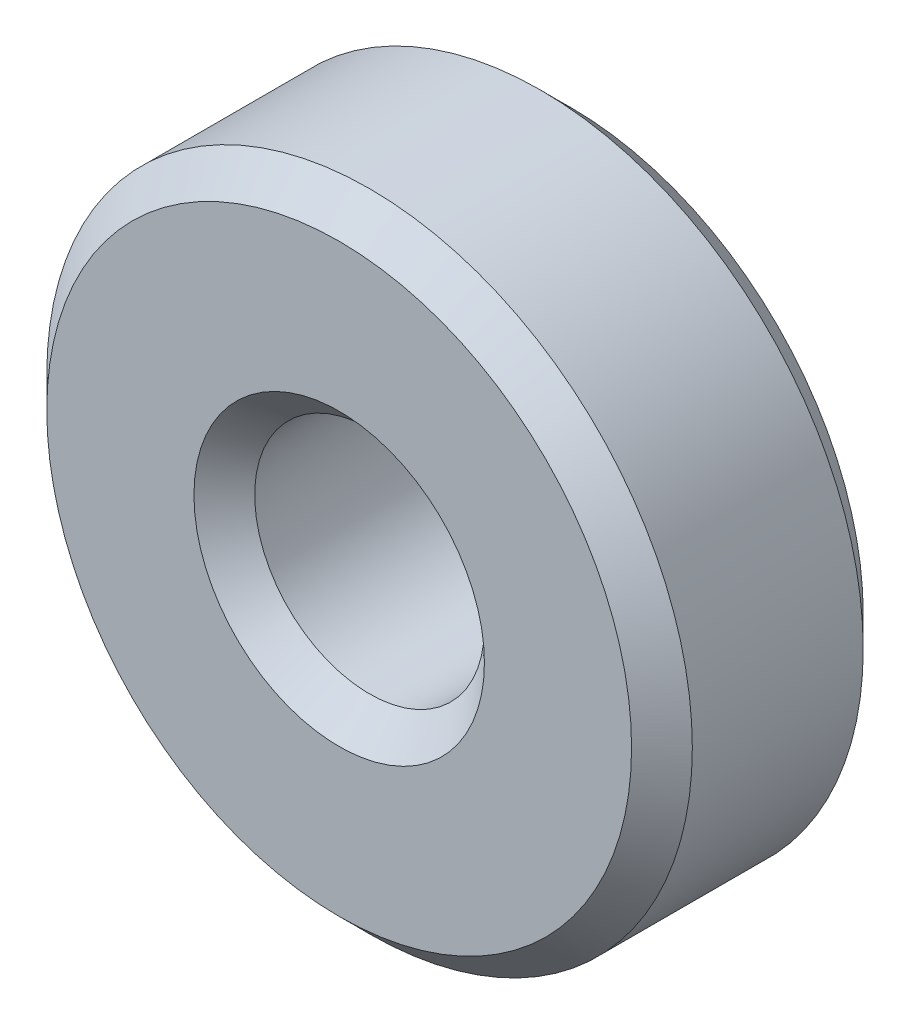
from build123d import *

# Parameters (mm, degrees)
SKETCH1_R           = 8.5
SKETCH1_R_2         = 3.025
BOSS_EXTRUDE1_DEPTH = 3.05
CHAMFER1_SIZE       = 0.8


with BuildPart() as part:
    # Sketch1 → Boss-Extrude1 (new, symmetric)
    with BuildSketch(Plane.XY):
        Circle(SKETCH1_R)
        Circle(SKETCH1_R_2, mode=Mode.SUBTRACT)
    extrude(amount=BOSS_EXTRUDE1_DEPTH, both=True)

    # Chamfer1
    chamfer1_edges = [part.edges().sort_by_distance(p)[0] for p in [
        (-3.025, 0, -3.05),
        (-3.025, 0, 3.05),
        (-8.5, 0, -3.05),
        (-8.5, 0, 3.05),
    ]]
    chamfer(chamfer1_edges, length=CHAMFER1_SIZE)


solid = part.part
